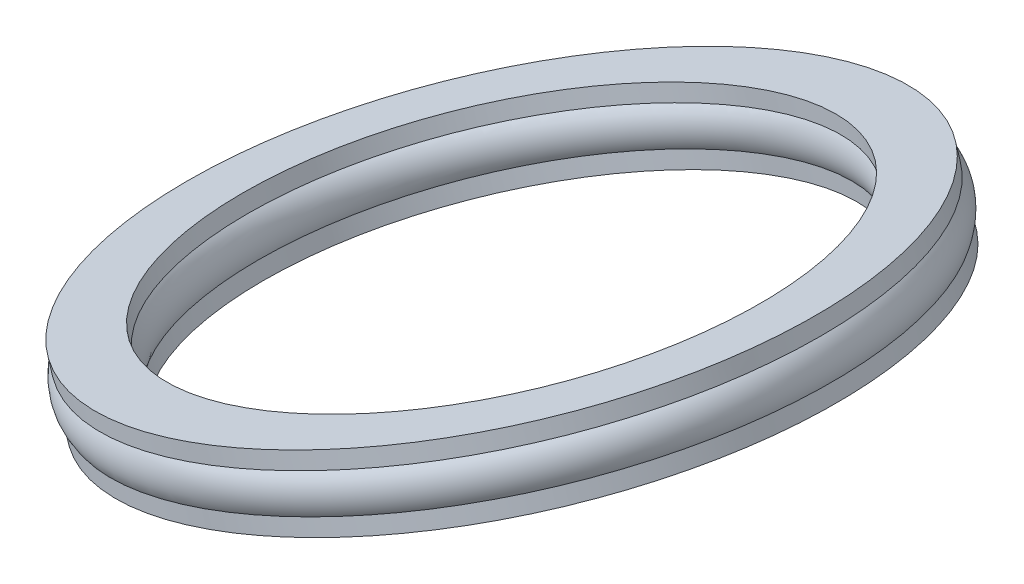
from build123d import *

# Parameters (mm, degrees)
SK_BOLAS_R = 2


with BuildPart() as part:
    # Sk_Jaula → Jaula (revolve)
    with BuildSketch(Plane.XY):
        Polygon((380.263685582, 538.327285598), (383.50631412, 539.349714159), (384.709171251, 535.534857055), (381.466542713, 534.512428494), align=None)
    revolve(axis=Axis((363.691428608, 538.344571312, 0), (0.3007142826457713, -0.9537142759825079, 0)))

    # Sk_Bolas → Bolas (revolve)
    with BuildSketch(Plane.XY):
        with Locations((382.486428416, 536.931071326)):
            Circle(SK_BOLAS_R)
    revolve(axis=Axis((362.78928576, 541.20571414, 0), (0.3007142826457754, -0.9537142759825067, 0)))


solid = part.part
